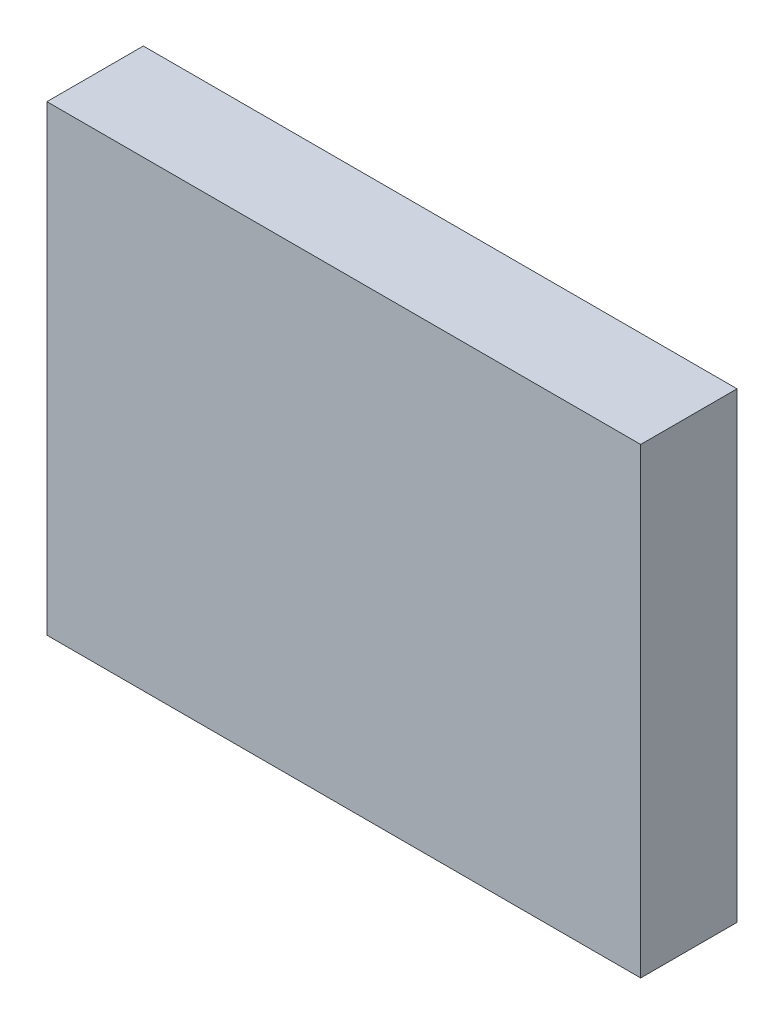
from build123d import *

# Parameters (mm, degrees)
SKETCH1_W           = 61.603248292
SKETCH1_H           = 47.942276913
BOSS_EXTRUDE1_DEPTH = 10


with BuildPart() as part:
    # Sketch1 → Boss-Extrude1 (new body)
    with BuildSketch(Plane.XY):
        with Locations((30.801624146, 23.971138457)):
            Rectangle(SKETCH1_W, SKETCH1_H)
    extrude(amount=BOSS_EXTRUDE1_DEPTH)


solid = part.part
